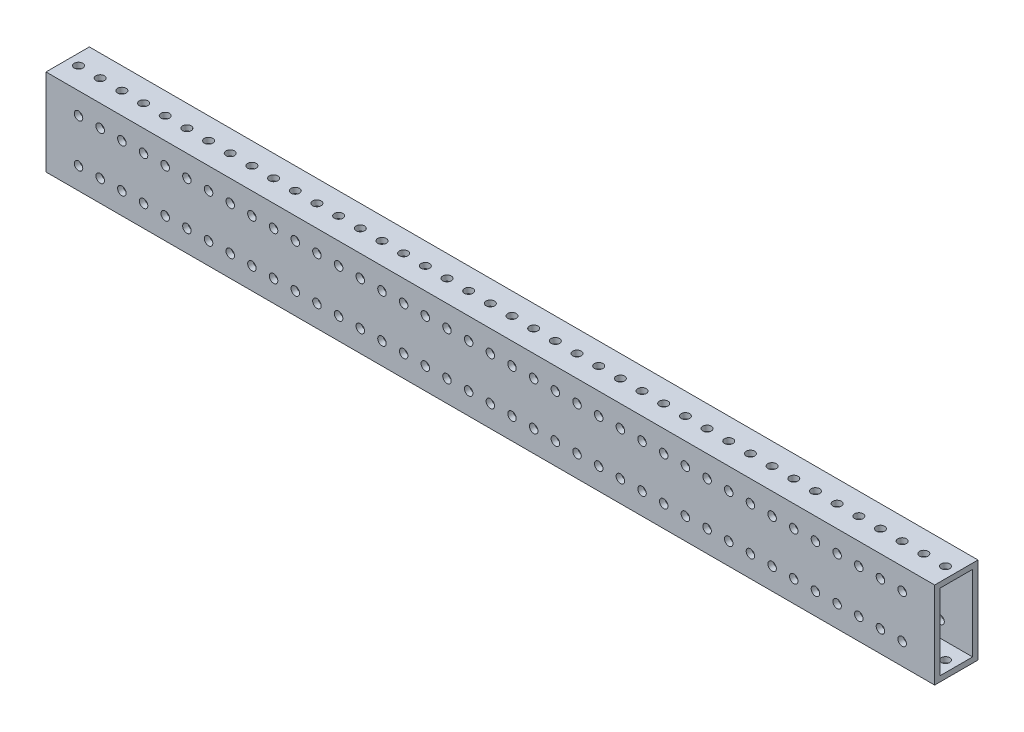
from build123d import *

# Parameters (mm, degrees)
SKETCH1_W           = 520.7
SKETCH1_H           = 50.8
BOSS_EXTRUDE1_DEPTH = 25.4
SHELL1_T            = -3.175
SKETCH2_R           = 2.4892
CUT_EXTRUDE1_DEPTH  = 25.4
SKETCH3_R           = 2.4892
CUT_EXTRUDE2_DEPTH  = 50.8


with BuildPart() as part:
    # Sketch1 → Boss-Extrude1 (new body)
    with BuildSketch(Plane.XY):
        with Locations((260.35, 25.4)):
            Rectangle(SKETCH1_W, SKETCH1_H)
    extrude(amount=BOSS_EXTRUDE1_DEPTH)

    # Shell1
    shell1_openings = [part.faces().sort_by_distance(p)[0] for p in [
        (520.7, 25.4, 12.7),
        (0, 25.4, 12.7),
    ]]
    offset(amount=SHELL1_T, openings=shell1_openings, kind=Kind.INTERSECTION)

    # Sketch2 → Cut-Extrude1 (cut)
    with BuildSketch(Plane(origin=(0, 0, 0), x_dir=(-1, 0, 0), z_dir=(0, 0, -1))):
        with Locations((-501.65, 38.1)):
            Circle(SKETCH2_R)
        with Locations((-488.95, 38.1)):
            Circle(SKETCH2_R)
        with Locations((-476.25, 38.1)):
            Circle(SKETCH2_R)
        with Locations((-463.55, 38.1)):
            Circle(SKETCH2_R)
        with Locations((-450.85, 38.1)):
            Circle(SKETCH2_R)
        with Locations((-438.15, 38.1)):
            Circle(SKETCH2_R)
        with Locations((-425.45, 38.1)):
            Circle(SKETCH2_R)
        with Locations((-412.75, 38.1)):
            Circle(SKETCH2_R)
        with Locations((-400.05, 38.1)):
            Circle(SKETCH2_R)
        with Locations((-387.35, 38.1)):
            Circle(SKETCH2_R)
        with Locations((-374.65, 38.1)):
            Circle(SKETCH2_R)
        with Locations((-361.95, 38.1)):
            Circle(SKETCH2_R)
        with Locations((-349.25, 38.1)):
            Circle(SKETCH2_R)
        with Locations((-336.55, 38.1)):
            Circle(SKETCH2_R)
        with Locations((-323.85, 38.1)):
            Circle(SKETCH2_R)
        with Locations((-311.15, 38.1)):
            Circle(SKETCH2_R)
        with Locations((-298.45, 38.1)):
            Circle(SKETCH2_R)
        with Locations((-285.75, 38.1)):
            Circle(SKETCH2_R)
        with Locations((-273.05, 38.1)):
            Circle(SKETCH2_R)
        with Locations((-260.35, 38.1)):
            Circle(SKETCH2_R)
        with Locations((-247.65, 38.1)):
            Circle(SKETCH2_R)
        with Locations((-234.95, 38.1)):
            Circle(SKETCH2_R)
        with Locations((-222.25, 38.1)):
            Circle(SKETCH2_R)
        with Locations((-209.55, 38.1)):
            Circle(SKETCH2_R)
        with Locations((-196.85, 38.1)):
            Circle(SKETCH2_R)
        with Locations((-184.15, 38.1)):
            Circle(SKETCH2_R)
        with Locations((-171.45, 38.1)):
            Circle(SKETCH2_R)
        with Locations((-158.75, 38.1)):
            Circle(SKETCH2_R)
        with Locations((-146.05, 38.1)):
            Circle(SKETCH2_R)
        with Locations((-133.35, 38.1)):
            Circle(SKETCH2_R)
        with Locations((-120.65, 38.1)):
            Circle(SKETCH2_R)
        with Locations((-107.95, 38.1)):
            Circle(SKETCH2_R)
        with Locations((-95.25, 38.1)):
            Circle(SKETCH2_R)
        with Locations((-82.55, 38.1)):
            Circle(SKETCH2_R)
        with Locations((-69.85, 38.1)):
            Circle(SKETCH2_R)
        with Locations((-57.15, 38.1)):
            Circle(SKETCH2_R)
        with Locations((-44.45, 38.1)):
            Circle(SKETCH2_R)
        with Locations((-31.75, 38.1)):
            Circle(SKETCH2_R)
        with Locations((-19.05, 38.1)):
            Circle(SKETCH2_R)
        with Locations((-488.95, 12.7)):
            Circle(SKETCH2_R)
        with Locations((-476.25, 12.7)):
            Circle(SKETCH2_R)
        with Locations((-463.55, 12.7)):
            Circle(SKETCH2_R)
        with Locations((-450.85, 12.7)):
            Circle(SKETCH2_R)
        with Locations((-438.15, 12.7)):
            Circle(SKETCH2_R)
        with Locations((-425.45, 12.7)):
            Circle(SKETCH2_R)
        with Locations((-412.75, 12.7)):
            Circle(SKETCH2_R)
        with Locations((-400.05, 12.7)):
            Circle(SKETCH2_R)
        with Locations((-387.35, 12.7)):
            Circle(SKETCH2_R)
        with Locations((-374.65, 12.7)):
            Circle(SKETCH2_R)
        with Locations((-361.95, 12.7)):
            Circle(SKETCH2_R)
        with Locations((-349.25, 12.7)):
            Circle(SKETCH2_R)
        with Locations((-336.55, 12.7)):
            Circle(SKETCH2_R)
        with Locations((-323.85, 12.7)):
            Circle(SKETCH2_R)
        with Locations((-311.15, 12.7)):
            Circle(SKETCH2_R)
        with Locations((-298.45, 12.7)):
            Circle(SKETCH2_R)
        with Locations((-285.75, 12.7)):
            Circle(SKETCH2_R)
        with Locations((-273.05, 12.7)):
            Circle(SKETCH2_R)
        with Locations((-260.35, 12.7)):
            Circle(SKETCH2_R)
        with Locations((-247.65, 12.7)):
            Circle(SKETCH2_R)
        with Locations((-234.95, 12.7)):
            Circle(SKETCH2_R)
        with Locations((-222.25, 12.7)):
            Circle(SKETCH2_R)
        with Locations((-209.55, 12.7)):
            Circle(SKETCH2_R)
        with Locations((-196.85, 12.7)):
            Circle(SKETCH2_R)
        with Locations((-184.15, 12.7)):
            Circle(SKETCH2_R)
        with Locations((-171.45, 12.7)):
            Circle(SKETCH2_R)
        with Locations((-158.75, 12.7)):
            Circle(SKETCH2_R)
        with Locations((-146.05, 12.7)):
            Circle(SKETCH2_R)
        with Locations((-133.35, 12.7)):
            Circle(SKETCH2_R)
        with Locations((-120.65, 12.7)):
            Circle(SKETCH2_R)
        with Locations((-107.95, 12.7)):
            Circle(SKETCH2_R)
        with Locations((-95.25, 12.7)):
            Circle(SKETCH2_R)
        with Locations((-82.55, 12.7)):
            Circle(SKETCH2_R)
        with Locations((-69.85, 12.7)):
            Circle(SKETCH2_R)
        with Locations((-57.15, 12.7)):
            Circle(SKETCH2_R)
        with Locations((-44.45, 12.7)):
            Circle(SKETCH2_R)
        with Locations((-31.75, 12.7)):
            Circle(SKETCH2_R)
        with Locations((-19.05, 12.7)):
            Circle(SKETCH2_R)
        with Locations((-501.65, 12.7)):
            Circle(SKETCH2_R)
    extrude(amount=-CUT_EXTRUDE1_DEPTH, mode=Mode.SUBTRACT)

    # Sketch3 → Cut-Extrude2 (cut)
    with BuildSketch(Plane(origin=(0, 50.8, 0), x_dir=(1, 0, 0), z_dir=(0, 1, 0))):
        with Locations((6.35, -12.7)):
            Circle(SKETCH3_R)
        with Locations((19.05, -12.7)):
            Circle(SKETCH3_R)
        with Locations((31.75, -12.7)):
            Circle(SKETCH3_R)
        with Locations((44.45, -12.7)):
            Circle(SKETCH3_R)
        with Locations((57.15, -12.7)):
            Circle(SKETCH3_R)
        with Locations((69.85, -12.7)):
            Circle(SKETCH3_R)
        with Locations((82.55, -12.7)):
            Circle(SKETCH3_R)
        with Locations((95.25, -12.7)):
            Circle(SKETCH3_R)
        with Locations((107.95, -12.7)):
            Circle(SKETCH3_R)
        with Locations((120.65, -12.7)):
            Circle(SKETCH3_R)
        with Locations((133.35, -12.7)):
            Circle(SKETCH3_R)
        with Locations((146.05, -12.7)):
            Circle(SKETCH3_R)
        with Locations((158.75, -12.7)):
            Circle(SKETCH3_R)
        with Locations((171.45, -12.7)):
            Circle(SKETCH3_R)
        with Locations((184.15, -12.7)):
            Circle(SKETCH3_R)
        with Locations((196.85, -12.7)):
            Circle(SKETCH3_R)
        with Locations((209.55, -12.7)):
            Circle(SKETCH3_R)
        with Locations((222.25, -12.7)):
            Circle(SKETCH3_R)
        with Locations((234.95, -12.7)):
            Circle(SKETCH3_R)
        with Locations((247.65, -12.7)):
            Circle(SKETCH3_R)
        with Locations((260.35, -12.7)):
            Circle(SKETCH3_R)
        with Locations((273.05, -12.7)):
            Circle(SKETCH3_R)
        with Locations((285.75, -12.7)):
            Circle(SKETCH3_R)
        with Locations((298.45, -12.7)):
            Circle(SKETCH3_R)
        with Locations((311.15, -12.7)):
            Circle(SKETCH3_R)
        with Locations((323.85, -12.7)):
            Circle(SKETCH3_R)
        with Locations((336.55, -12.7)):
            Circle(SKETCH3_R)
        with Locations((349.25, -12.7)):
            Circle(SKETCH3_R)
        with Locations((361.95, -12.7)):
            Circle(SKETCH3_R)
        with Locations((374.65, -12.7)):
            Circle(SKETCH3_R)
        with Locations((387.35, -12.7)):
            Circle(SKETCH3_R)
        with Locations((400.05, -12.7)):
            Circle(SKETCH3_R)
        with Locations((412.75, -12.7)):
            Circle(SKETCH3_R)
        with Locations((425.45, -12.7)):
            Circle(SKETCH3_R)
        with Locations((438.15, -12.7)):
            Circle(SKETCH3_R)
        with Locations((450.85, -12.7)):
            Circle(SKETCH3_R)
        with Locations((463.55, -12.7)):
            Circle(SKETCH3_R)
        with Locations((476.25, -12.7)):
            Circle(SKETCH3_R)
        with Locations((488.95, -12.7)):
            Circle(SKETCH3_R)
        with Locations((501.65, -12.7)):
            Circle(SKETCH3_R)
        with Locations((514.35, -12.7)):
            Circle(SKETCH3_R)
    extrude(amount=-CUT_EXTRUDE2_DEPTH, mode=Mode.SUBTRACT)


solid = part.part
